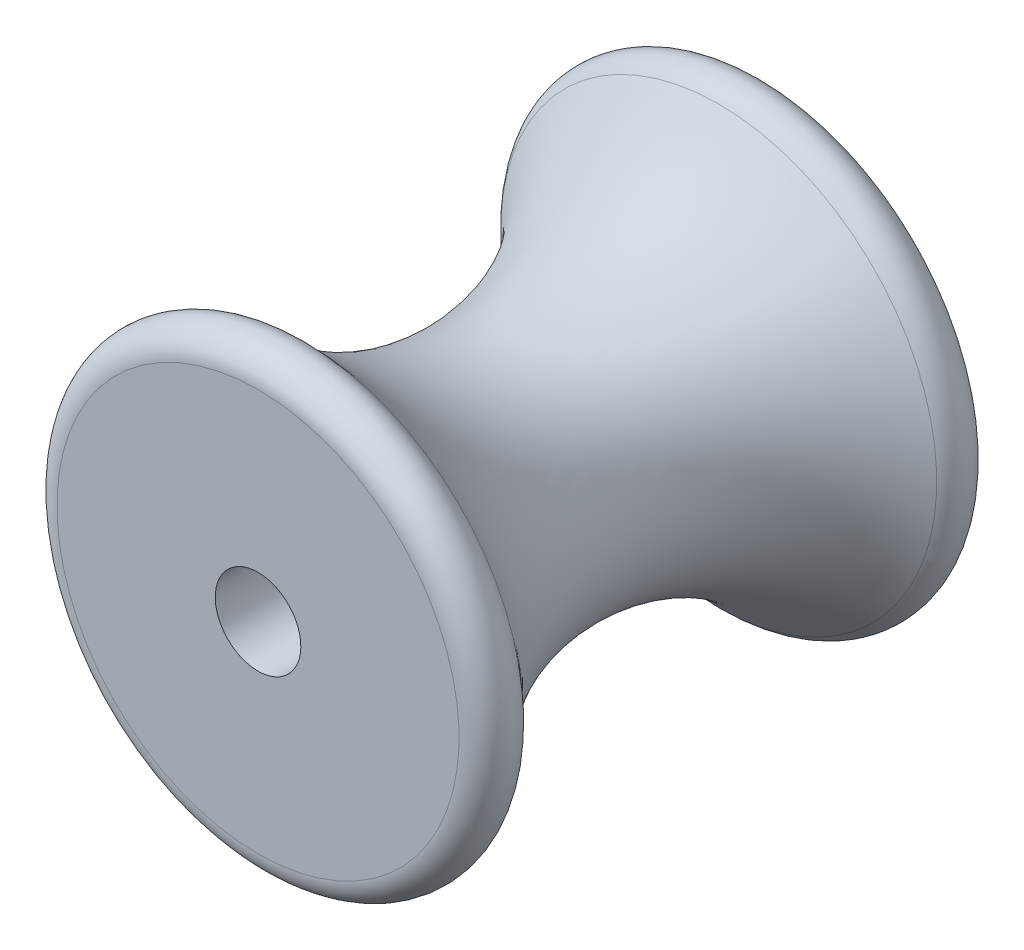
from build123d import *

# Parameters (mm, degrees)
FILLET1_R = 1


with BuildPart() as part:
    # Sketch1 → Revolve1 (revolve)
    with BuildSketch(Plane(origin=(0, 0, 0), x_dir=(0, 0, -1), z_dir=(1, 0, 0))):
        with BuildLine():
            Line((-9.5, 1.6), (9.5, 1.6))
            Line((9.5, 1.6), (9.5, 11.377501001))
            ThreePointArc((9.5, 11.377501001), (0, 4.5), (-9.5, 11.377501001))
            Line((-9.5, 11.377501001), (-9.5, 1.6))
        make_face()
    revolve(axis=Axis((0, 0, -10), (0, 0, 1)))

    # Fillet1
    fillet1_edges = [part.edges().sort_by_distance(p)[0] for p in [
        (0, -11.377501001, 9.5),
        (0, -11.377501001, -9.5),
    ]]
    fillet(fillet1_edges, radius=FILLET1_R)


solid = part.part
